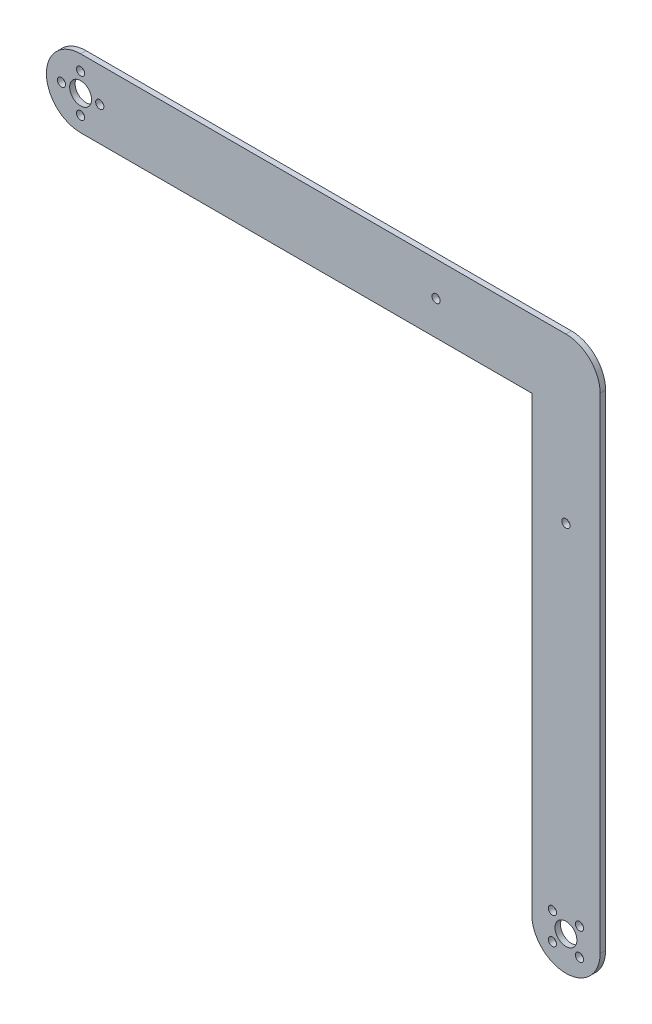
from build123d import *

# Parameters (mm, degrees)
SKETCH_1_R      = 4
SKETCH_1_R_2    = 1.5
EXTRUDE_2_DEPTH = 2


with BuildPart() as part:
    # 草图1 → 凸台-拉伸2 (new body)
    with BuildSketch(Plane.XY):
        with BuildLine():
            Line((12.5, 0), (12.5, 177.5))
            ThreePointArc((12.5, 177.5), (8.838834765, 186.338834765), (0, 190))
            Line((0, 190), (-177.5, 190))
            ThreePointArc((-177.5, 190), (-190, 177.5), (-177.5, 165))
            Line((-177.5, 165), (-12.5, 165))
            Line((-12.5, 165), (-12.5, 0))
            ThreePointArc((-12.5, 0), (0, -12.5), (12.5, 0))
        make_face()
        Circle(SKETCH_1_R, mode=Mode.SUBTRACT)
        with Locations((0, 130)):
            Circle(SKETCH_1_R_2, mode=Mode.SUBTRACT)
        with Locations((4.949747468, 4.949747468)):
            Circle(SKETCH_1_R_2, mode=Mode.SUBTRACT)
        with Locations((4.949747468, -4.949747468)):
            Circle(SKETCH_1_R_2, mode=Mode.SUBTRACT)
        with Locations((-4.949747468, -4.949747468)):
            Circle(SKETCH_1_R_2, mode=Mode.SUBTRACT)
        with Locations((-4.949747468, 4.949747468)):
            Circle(SKETCH_1_R_2, mode=Mode.SUBTRACT)
        with Locations((-177.5, 177.5)):
            Circle(SKETCH_1_R, mode=Mode.SUBTRACT)
        with Locations((-177.5, 184.5)):
            Circle(SKETCH_1_R_2, mode=Mode.SUBTRACT)
        with Locations((-170.5, 177.5)):
            Circle(SKETCH_1_R_2, mode=Mode.SUBTRACT)
        with Locations((-177.5, 170.5)):
            Circle(SKETCH_1_R_2, mode=Mode.SUBTRACT)
        with Locations((-184.5, 177.5)):
            Circle(SKETCH_1_R_2, mode=Mode.SUBTRACT)
        with Locations((-47.5, 177.5)):
            Circle(SKETCH_1_R_2, mode=Mode.SUBTRACT)
    extrude(amount=EXTRUDE_2_DEPTH)


solid = part.part
